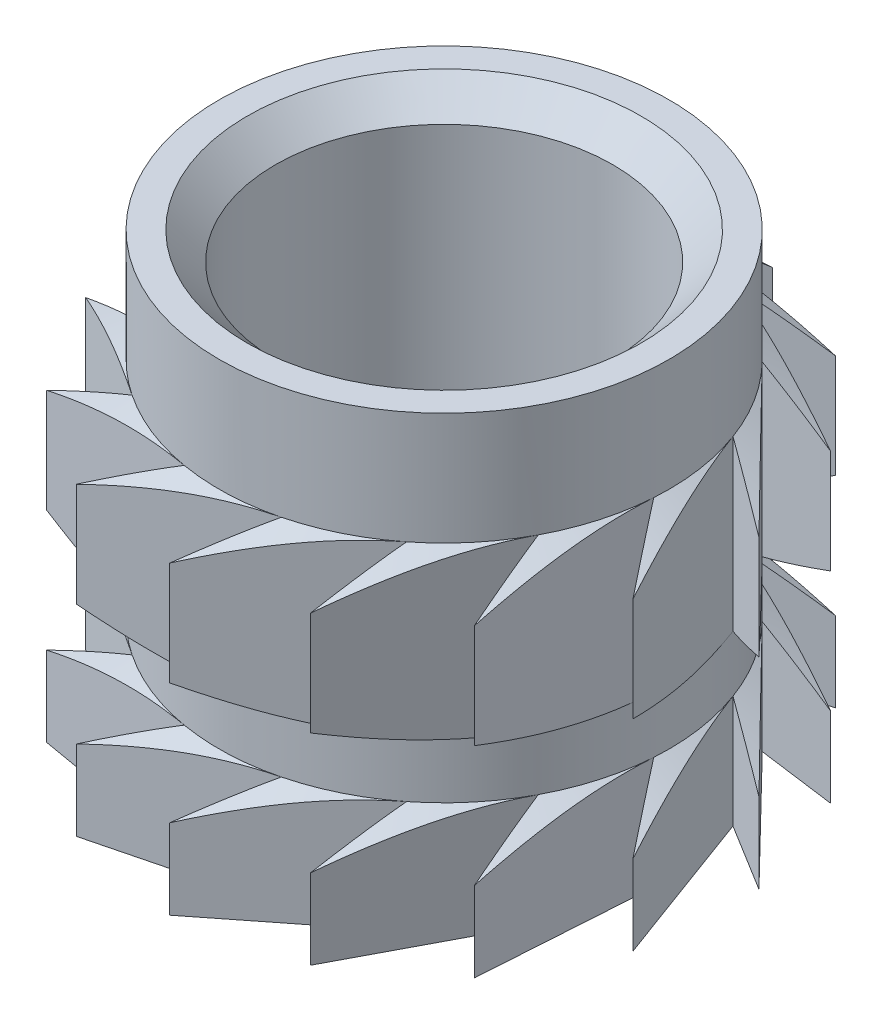
from build123d import *

# Parameters (mm, degrees)
SKETCH1_R           = 2
SKETCH1_R_2         = 1.5
BOSS_EXTRUDE1_DEPTH = 4
CUT_EXTRUDE3_DEPTH  = 6.338539126
CHAMFER1_SIZE       = 0.25


with BuildPart() as part:
    # Sketch1 → Boss-Extrude1 (new body)
    with BuildSketch(Plane(origin=(0, 0, 0), x_dir=(1, 0, 0), z_dir=(0, 1, 0))):
        Circle(SKETCH1_R)
        Circle(SKETCH1_R_2, mode=Mode.SUBTRACT)
    extrude(amount=BOSS_EXTRUDE1_DEPTH)

    # Sketch2 → Revolve1 (revolve)
    with BuildSketch(Plane.XY):
        Polygon((2, 3), (2.5, 2.711324865), (2.5, 1.788675135), (2, 1.5), align=None)
        Polygon((2, 0), (2.5, 0), (2.5, 0.711324865), (2, 1), align=None)
    revolve(axis=Axis((0, 0, 0), (0, 1, 0)))

    # Sketch3 → Cut-Extrude3 (cut, through all)
    with BuildSketch(Plane(origin=(0, 4, 0), x_dir=(1, 0, 0), z_dir=(0, 1, 0))):
        with BuildLine():
            Line((0.462232224, 2.456896695), (-0.077299176, 1.998505651))
            Line((-0.077299176, 1.998505651), (1.421580063, 2.056480033))
            ThreePointArc((1.421580063, 2.056480033), (0.962948887, 2.307104125), (0.462232224, 2.456896695))
        make_face()
        with BuildLine():
            ThreePointArc((2.135123794, 1.30047929), (1.818081368, 1.715977896), (1.421580063, 2.056480033))
            Line((1.421580063, 2.056480033), (0.742249169, 1.857166167))
            Line((0.742249169, 1.857166167), (2.135123794, 1.30047929))
        make_face()
        with BuildLine():
            Line((-0.883481791, 1.794285352), (0.462232224, 2.456896695))
            ThreePointArc((0.462232224, 2.456896695), (-0.058686206, 2.499311091), (-0.577039766, 2.432493599))
            Line((-0.577039766, 2.432493599), (-0.883481791, 1.794285352))
        make_face()
        with BuildLine():
            ThreePointArc((2.479485224, 0.319613864), (2.358851064, 0.8281435), (2.135123794, 1.30047929))
            Line((2.135123794, 1.30047929), (1.433455889, 1.394705781))
            Line((1.433455889, 1.394705781), (2.479485224, 0.319613864))
        make_face()
        with BuildLine():
            Line((-1.536902378, 1.279816816), (-0.577039766, 2.432493599))
            ThreePointArc((-0.577039766, 2.432493599), (-1.07017392, 2.259364464), (-1.516536338, 1.987490261))
            Line((-1.516536338, 1.987490261), (-1.536902378, 1.279816816))
        make_face()
        with BuildLine():
            ThreePointArc((2.395121134, -0.716515703), (2.491753982, -0.202884431), (2.479485224, 0.319613864))
            Line((2.479485224, 0.319613864), (1.876805063, 0.691088094))
            Line((1.876805063, 0.691088094), (2.395121134, -0.716515703))
        make_face()
        with BuildLine():
            Line((-1.924578581, 0.544056325), (-1.516536338, 1.987490261))
            ThreePointArc((-1.516536338, 1.987490261), (-1.896618841, 1.628753196), (-2.193809999, 1.198831801))
            Line((-2.193809999, 1.198831801), (-1.924578581, 0.544056325))
        make_face()
        with BuildLine():
            Line((-1.979477664, -0.285776447), (-2.193809999, 1.198831801))
            ThreePointArc((-2.193809999, 1.198831801), (-2.395121134, 0.716515703), (-2.491753982, 0.202884431))
            Line((-2.491753982, 0.202884431), (-1.979477664, -0.285776447))
        make_face()
        with BuildLine():
            ThreePointArc((1.896618841, -1.628753196), (2.193809999, -1.198831801), (2.395121134, -0.716515703))
            Line((2.395121134, -0.716515703), (1.995637592, -0.132025002))
            Line((1.995637592, -0.132025002), (1.896618841, -1.628753196))
        make_face()
        with BuildLine():
            Line((-1.692107076, -1.066195875), (-2.491753982, 0.202884431))
            ThreePointArc((-2.491753982, 0.202884431), (-2.479485224, -0.319613864), (-2.358851064, -0.8281435))
            Line((-2.358851064, -0.8281435), (-1.692107076, -1.066195875))
        make_face()
        with BuildLine():
            ThreePointArc((1.07017392, -2.259364464), (1.516536338, -1.987490261), (1.896618841, -1.628753196))
            Line((1.896618841, -1.628753196), (1.769406251, -0.932309776))
            Line((1.769406251, -0.932309776), (1.07017392, -2.259364464))
        make_face()
        with BuildLine():
            Line((-1.112155801, -1.662260351), (-2.358851064, -0.8281435))
            ThreePointArc((-2.358851064, -0.8281435), (-2.135123794, -1.30047929), (-1.818081368, -1.715977896))
            Line((-1.818081368, -1.715977896), (-1.112155801, -1.662260351))
        make_face()
        with BuildLine():
            ThreePointArc((0.058686206, -2.499311091), (0.577039766, -2.432493599), (1.07017392, -2.259364464))
            Line((1.07017392, -2.259364464), (1.237228495, -1.57138972))
            Line((1.237228495, -1.57138972), (0.058686206, -2.499311091))
        make_face()
        with BuildLine():
            Line((-0.339902686, -1.97090491), (-1.818081368, -1.715977896))
            ThreePointArc((-1.818081368, -1.715977896), (-1.421580063, -2.056480033), (-0.962948887, -2.307104125))
            Line((-0.962948887, -2.307104125), (-0.339902686, -1.97090491))
        make_face()
        with BuildLine():
            ThreePointArc((-0.962948887, -2.307104125), (-0.462232224, -2.456896695), (0.058686206, -2.499311091))
            Line((0.058686206, -2.499311091), (0.491122692, -1.938762105))
            Line((0.491122692, -1.938762105), (-0.962948887, -2.307104125))
        make_face()
    extrude(amount=-CUT_EXTRUDE3_DEPTH, mode=Mode.SUBTRACT)

    # Chamfer1
    chamfer1_edges = [part.edges().sort_by_distance(p)[0] for p in [
        (-1.5, 4, 0),
        (-1.5, 0, 0),
    ]]
    chamfer(chamfer1_edges, length=CHAMFER1_SIZE)


solid = part.part
